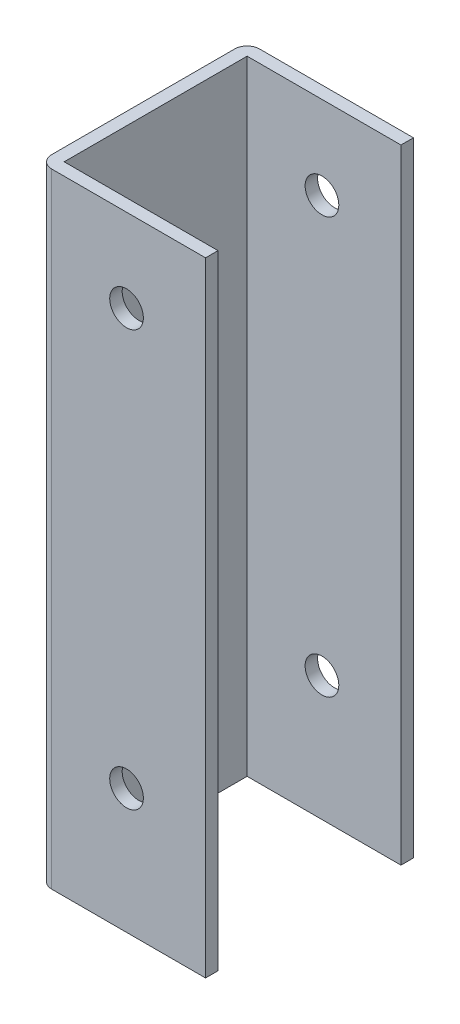
from build123d import *

# Parameters (mm, degrees)
SKETCH_1_W          = 74
SKETCH_1_H          = 44
EXTRUDE_1_DEPTH     = 150
SKETCH_2_W          = 41.146480438
SKETCH_2_H          = 58.393385187
CUT_EXTRUDE_1_DEPTH = 158.241851935
SKETCH_3_R          = 4.05
CUT_EXTRUDE_2_DEPTH = 164.095064303


with BuildPart() as part:
    # Эскиз1 → Вытянуть-Тонкостенный1 (new body)
    with BuildSketch(Plane(origin=(0, 0, 0), x_dir=(1, 0, 0), z_dir=(0, 1, 0))):
        with BuildLine():
            Line((40, 22), (40, -22))
            ThreePointArc((40, -22), (39.121320344, -24.121320344), (37, -25))
            Line((37, -25), (-37, -25))
            ThreePointArc((-37, -25), (-39.121320344, -24.121320344), (-40, -22))
            Line((-40, -22), (-40, 22))
            ThreePointArc((-40, 22), (-39.121320344, 24.121320344), (-37, 25))
            Line((-37, 25), (37, 25))
            ThreePointArc((37, 25), (39.121320344, 24.121320344), (40, 22))
        make_face()
        Rectangle(SKETCH_1_W, SKETCH_1_H, mode=Mode.SUBTRACT)
    extrude(amount=EXTRUDE_1_DEPTH)

    # Эскиз2 → Вырез-Вытянуть1 (cut, through all)
    with BuildSketch(Plane(origin=(0, 150, 0), x_dir=(1, 0, 0), z_dir=(0, 1, 0))):
        with Locations((20.573240219, 1.776081122)):
            Rectangle(SKETCH_2_W, SKETCH_2_H)
    extrude(amount=-CUT_EXTRUDE_1_DEPTH, mode=Mode.SUBTRACT)

    # Эскиз3 → Вырез-Вытянуть2 (cut, through all)
    with BuildSketch(Plane(origin=(0, 0, -25), x_dir=(-1, 0, 0), z_dir=(0, 0, -1))):
        with Locations((19, 130)):
            Circle(SKETCH_3_R)
        with Locations((19, 30)):
            Circle(SKETCH_3_R)
    extrude(amount=-CUT_EXTRUDE_2_DEPTH, mode=Mode.SUBTRACT)


solid = part.part
